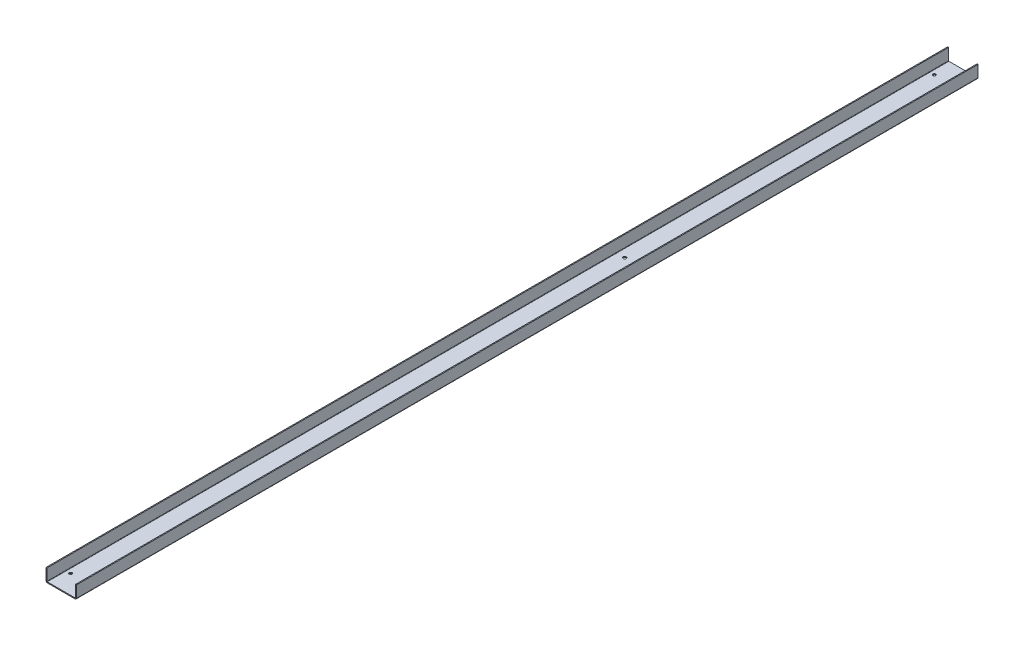
from build123d import *

# Parameters (mm, degrees)
SM_BASE_FLANGE_1_DEPTH    = 950
HOLE_WIZARD_6_0_6_1_D     = 6
HOLE_WIZARD_6_0_6_1_DEPTH = 15
HOLE_WIZARD_6_0_6_1_TIP   = 1.802581857
HOLE_WIZARD_6_5_6_5_1_D   = 6.5


# Sheet-metal steps are written as plain solids
with BuildPart() as part:
    # Sketch 1 → 基体-法兰1 (new, symmetric)
    with BuildSketch(Plane.XY):
        with BuildLine():
            Line((-30, 25), (-30, 0.7366))
            ThreePointArc((-30, 0.7366), (-29.784254855, 0.215745145), (-29.2634, 0))
            Line((-29.2634, 0), (29.2634, 0))
            ThreePointArc((29.2634, 0), (29.784254855, 0.215745145), (30, 0.7366))
            Line((30, 0.7366), (30, 25))
            Line((30, 25), (32, 25))
            Line((32, 25), (32, 0.7366))
            ThreePointArc((32, 0.7366), (31.198468417, -1.198468417), (29.2634, -2))
            Line((29.2634, -2), (-29.2634, -2))
            ThreePointArc((-29.2634, -2), (-31.198468417, -1.198468417), (-32, 0.7366))
            Line((-32, 0.7366), (-32, 25))
            Line((-32, 25), (-30, 25))
        make_face()
    extrude(amount=SM_BASE_FLANGE_1_DEPTH, both=True)

    # Ø6.0 (6) 直径孔1
    with Locations(Plane(origin=(-20, 0, -910), x_dir=(1, 0, 0), z_dir=(0, 1, 0))):
        with Locations((0, 0), (40, 0), (0, -1820), (40, -1820)):
            Hole(HOLE_WIZARD_6_0_6_1_D / 2, depth=HOLE_WIZARD_6_0_6_1_DEPTH)
            with Locations((0, 0, -(HOLE_WIZARD_6_0_6_1_DEPTH + HOLE_WIZARD_6_0_6_1_TIP / 2))):  # 118° drill point
                Cone(0, HOLE_WIZARD_6_0_6_1_D / 2, HOLE_WIZARD_6_0_6_1_TIP, mode=Mode.SUBTRACT)

    # Ø6.5 (6.5) 直径孔1 (through all)
    with Locations(Plane(origin=(-12.5, 0, -250), x_dir=(1, 0, 0), z_dir=(0, 1, 0))):
        with Locations((0, 0), (25, 0)):
            Hole(HOLE_WIZARD_6_5_6_5_1_D / 2)


solid = part.part
